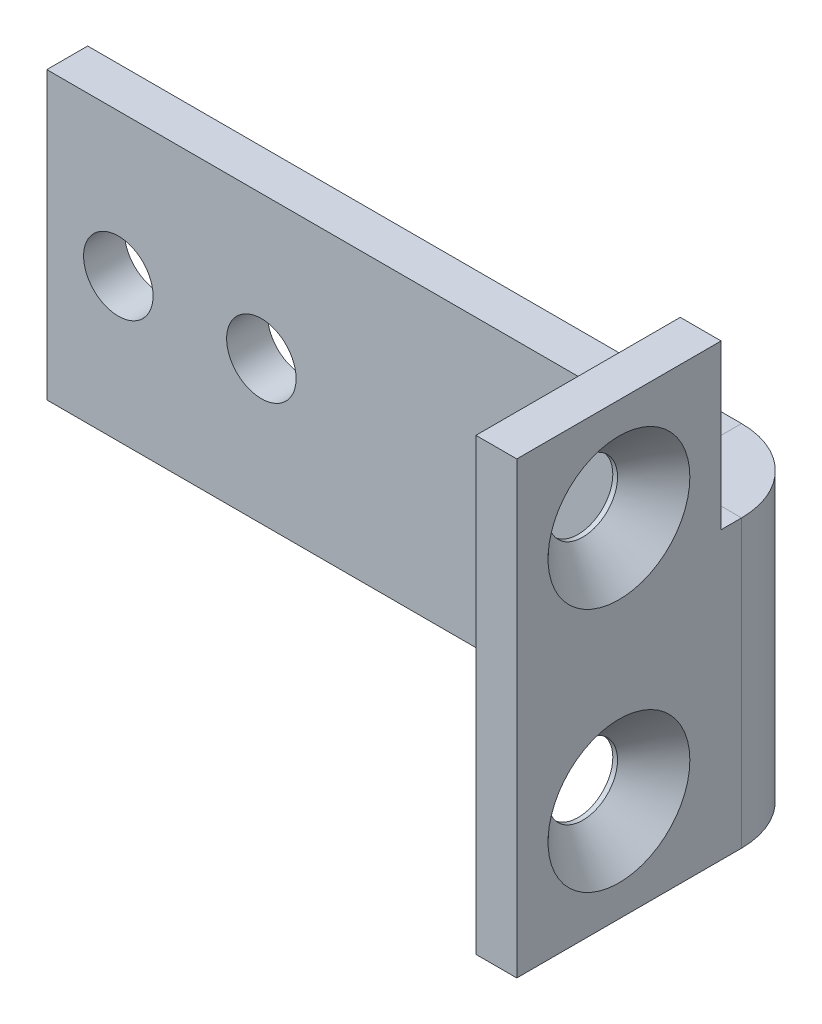
from build123d import *

# Parameters (mm, degrees)
SKIZZE1_W                                            = 34
SKIZZE1_H                                            = 14
BASIS_BLECH1_DEPTH                                   = 2
KANTE_LASCHE1_STRIP_W                                = 12
KANTE_LASCHE1_STRIP_H                                = 2
KANTE_LASCHE1_STRIP_CUT_DEPTH                        = 14
KANTE_LASCHE1_DEPTH                                  = 14
KANTE_LASCHE1_START                                  = 2
KANTE_LASCHE1_FLAT_DEPTH                             = 2
SKIZZE10_R                                           = 1.7
SCHNITT_LINEAR_AUSTRAGEN1_DEPTH                      = 45.147480109
FORMSENKUNG_F_R_M3_SENKSCHRAUBE_MIT_INNE_D           = 3.4
FORMSENKUNG_F_R_M3_SENKSCHRAUBE_MIT_INNE_CSINK_D     = 6.94
FORMSENKUNG_F_R_M3_SENKSCHRAUBE_MIT_INNE_CSINK_ANGLE = 90


# Sheet-metal steps are written as plain solids
with BuildPart() as part:
    # Skizze1 → Basis-Blech1 (new body)
    with BuildSketch(Plane.XY):
        with Locations((17, 7)):
            Rectangle(SKIZZE1_W, SKIZZE1_H)
    extrude(amount=-BASIS_BLECH1_DEPTH)

    # Kante-Lasche1 strip (across the edge) → Kante-Lasche1 strip cut (cut)
    with BuildSketch(Plane(origin=(34, 0, 0), x_dir=(-1, 0, 0), z_dir=(0, 1, 0))):
        with Locations((-4, -1)):
            Rectangle(KANTE_LASCHE1_STRIP_W, KANTE_LASCHE1_STRIP_H)
    extrude(amount=KANTE_LASCHE1_STRIP_CUT_DEPTH, mode=Mode.SUBTRACT)

    # Kante-Lasche1 bend section (across the edge) → Kante-Lasche1 (add)
    with BuildSketch(Plane(origin=(34, 0, 0), x_dir=(-1, 0, 0), z_dir=(0, 1, 0))):
        with BuildLine():
            Line((-2, 2), (0, 2))
            ThreePointArc((0, 2), (0.585786438, 0.585786438), (2, 0))
            Line((2, 0), (2, -2))
            ThreePointArc((2, -2), (-0.828427125, -0.828427125), (-2, 2))
        make_face()
    extrude(amount=KANTE_LASCHE1_DEPTH)

    # Kante-Lasche1 profile (on flange) → Kante-Lasche1 flat (add)
    with BuildSketch(Plane.YZ.offset(34).offset(KANTE_LASCHE1_START)):
        Polygon((0, 13), (0, 2), (14, 2), (14, 3), (22, 3), (22, 13), align=None)
    extrude(amount=-KANTE_LASCHE1_FLAT_DEPTH)

    # Skizze10 → Schnitt-Linear austragen1 (cut, through all)
    with BuildSketch(Plane.XY):
        with Locations((3.5, 7)):
            Circle(SKIZZE10_R)
        with Locations((10.5, 7)):
            Circle(SKIZZE10_R)
    extrude(amount=-SCHNITT_LINEAR_AUSTRAGEN1_DEPTH, mode=Mode.SUBTRACT)

    # Formsenkung für M3 Senkschraube mit Innensechskant1 (through all)
    with Locations(Plane(origin=(36, 0, 0), x_dir=(0, 0, -1), z_dir=(1, 0, 0))):
        with Locations((-8, 5), (-8, 17)):
            CounterSinkHole(FORMSENKUNG_F_R_M3_SENKSCHRAUBE_MIT_INNE_D / 2, FORMSENKUNG_F_R_M3_SENKSCHRAUBE_MIT_INNE_CSINK_D / 2, counter_sink_angle=FORMSENKUNG_F_R_M3_SENKSCHRAUBE_MIT_INNE_CSINK_ANGLE)


solid = part.part
